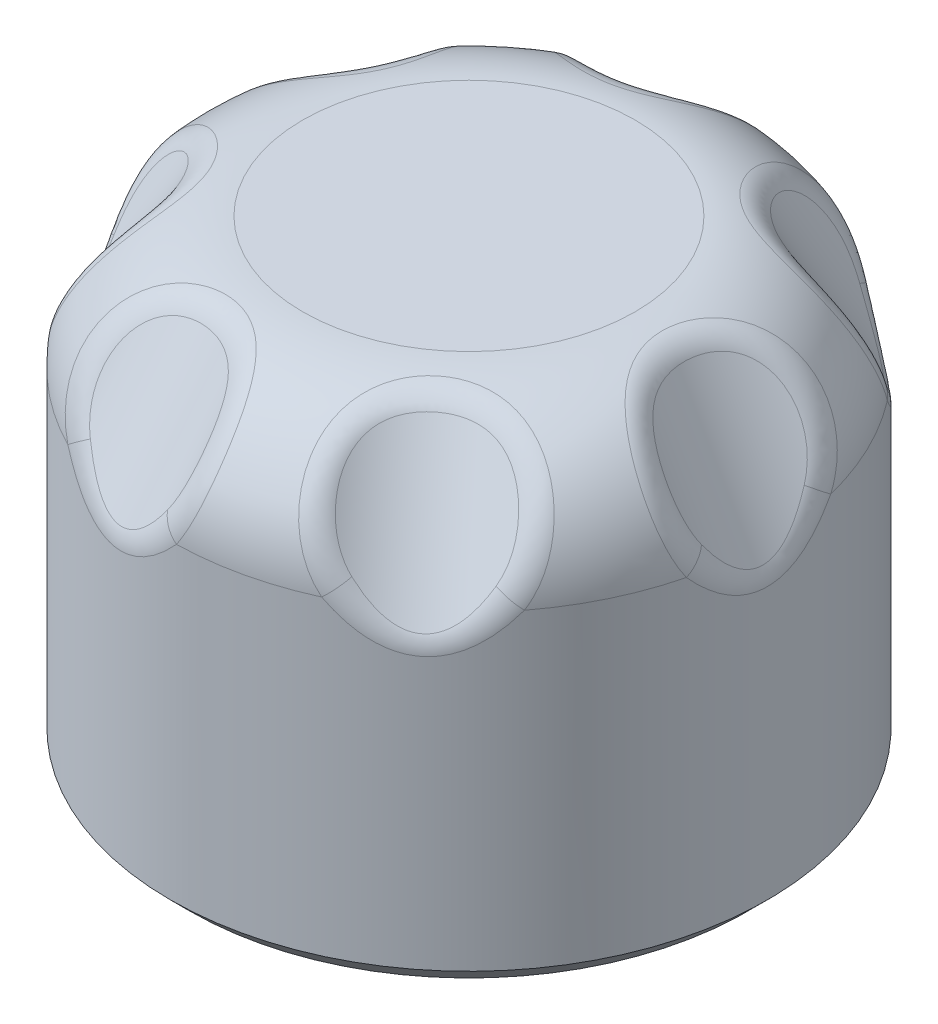
from build123d import *

# Parameters (mm, degrees)
SKETCH2_R                = 9.025
BOSS_EXTRUDE1_DEPTH      = 14
FILLET1_R                = 4
FILLET2_R                = 1
CIRPATTERN1_COUNT        = 7
FILLET2_OF_CIRPATTERN1_R = 1
BOSS_EXTRUDE2_START      = 6.75
BOSS_EXTRUDE2_DEPTH      = 6.75
CHAMFER1_SIZE            = 1.5
CHAMFER2_SIZE            = 0.75
CHAMFER3_SIZE            = 0.6


with BuildPart() as part:
    # Sketch2 → Boss-Extrude1 (new body)
    with BuildSketch(Plane(origin=(0, 0, 0), x_dir=(1, 0, 0), z_dir=(0, 1, 0))):
        with Locations(Location((0, 0, 0), (0, 0, 270))):
            Circle(SKETCH2_R)
    extrude(amount=BOSS_EXTRUDE1_DEPTH)

    # Fillet1
    fillet1_edges = [part.edges().sort_by_distance(p)[0] for p in [
        (0, 14, -9.025),
    ]]
    fillet(fillet1_edges, radius=FILLET1_R)

    # Sketch3 → Cut-Revolve1 (revolve, cut)
    with BuildSketch(Plane.XY):
        Polygon((0, 32.703555308), (17.726705922, 2), (14.262604307, 0), (-3.464101615, 30.703555308), align=None)
    cut_revolve1 = revolve(axis=Axis((0, 32.703555308, 0), (0.5000000000000012, -0.8660254037844379, 0)), mode=Mode.SUBTRACT)

    # Fillet2
    fillet2_edges = [part.edges().sort_by_distance(p)[0] for p in [
        (9.025, 9.07179677, 0),
        (6.300200556, 13.791287847, 0),
    ]]
    fillet(fillet2_edges, radius=FILLET2_R)

    # CirPattern1: Cut-Revolve1 ×7 about axis
    cirpattern1_axis = Axis((0, 0, 0), (0, -1, 0))
    for i in range(1, CIRPATTERN1_COUNT):
        add(cut_revolve1.rotate(cirpattern1_axis, i * 360 / CIRPATTERN1_COUNT), mode=Mode.SUBTRACT)

    # Fillet2 of CirPattern1
    fillet2_of_cirpattern1_edges = [part.edges().sort_by_distance(p)[0] for p in [
        (5.626995462, 9.07179677, 7.056029129),
        (3.928110796, 13.791287847, 4.92569514),
        (-2.008251429, 9.07179677, 8.798724407),
        (-1.401926512, 13.791287847, 6.142241374),
        (-8.131244033, 9.07179677, 3.915800746),
        (-5.676284562, 13.791287847, 2.733554574),
        (-8.131244033, 9.07179677, -3.915800746),
        (-5.676284562, 13.791287847, -2.733554574),
        (-2.008251429, 9.07179677, -8.798724407),
        (-1.401926512, 13.791287847, -6.142241374),
        (5.626995462, 9.07179677, -7.056029129),
        (3.928110796, 13.791287847, -4.92569514),
    ]]
    fillet(fillet2_of_cirpattern1_edges, radius=FILLET2_OF_CIRPATTERN1_R)

    # Sketch5 → Cut-Revolve2 (revolve, cut)
    with BuildSketch(Plane.XY, mode=Mode.PRIVATE) as cut_revolve2_sk:
        Polygon((0, 12), (3.15, 12), (3.15, 1), (3.75, 1), (3.75, 0), (0, 0), align=None)
    revolve(cut_revolve2_sk.sketch.rotate(Axis((0, 12, 0), (0, -1, 0)), 180), axis=Axis((0, 12, 0), (0, -1, 0)), mode=Mode.SUBTRACT)

    # Sketch7 → Boss-Extrude2 (add)
    with BuildSketch(Plane.XZ.offset(-12).offset(BOSS_EXTRUDE2_START)):
        with BuildLine():
            Line((-1.6, 2.71339271), (-1.6, -2.71339271))
            ThreePointArc((-1.6, -2.71339271), (-3.15, 0), (-1.6, 2.71339271))
        make_face()
    extrude(amount=-BOSS_EXTRUDE2_DEPTH)

    # Chamfer1
    chamfer1_edges = [part.edges().sort_by_distance(p)[0] for p in [
        (-1.6, 5.25, 0),
    ]]
    chamfer(chamfer1_edges, length=CHAMFER1_SIZE)

    # Chamfer2
    # the kernel refuses this chamfer: 0.75 mm, written as the material it takes off along each edge
    with BuildSketch(Plane(origin=(0, 1, 0), x_dir=(-1, 0, 0), z_dir=(0, 0, 1))) as chamfer2_piece_1_section:
        Polygon((3.15, -CHAMFER2_SIZE), (3.15 + CHAMFER2_SIZE, 0), (3.15, 0), align=None)
    chamfer2_piece_1 = revolve(axis=Axis((0, 1, 0), (0, -1, 0)), mode=Mode.PRIVATE)
    chamfer2_piece_1 = chamfer2_piece_1 & Plane(origin=(0, 1.447602275, 0), x_dir=(-1, 0, 0), z_dir=(0, -1, 0)) * Cylinder(3.75, 16, mode=Mode.PRIVATE)
    add(chamfer2_piece_1, mode=Mode.SUBTRACT)

    # Chamfer3
    chamfer3_edges = [part.edges().sort_by_distance(p)[0] for p in [
        (0, 0, -9.025),
    ]]
    chamfer(chamfer3_edges, length=CHAMFER3_SIZE)


solid = part.part
